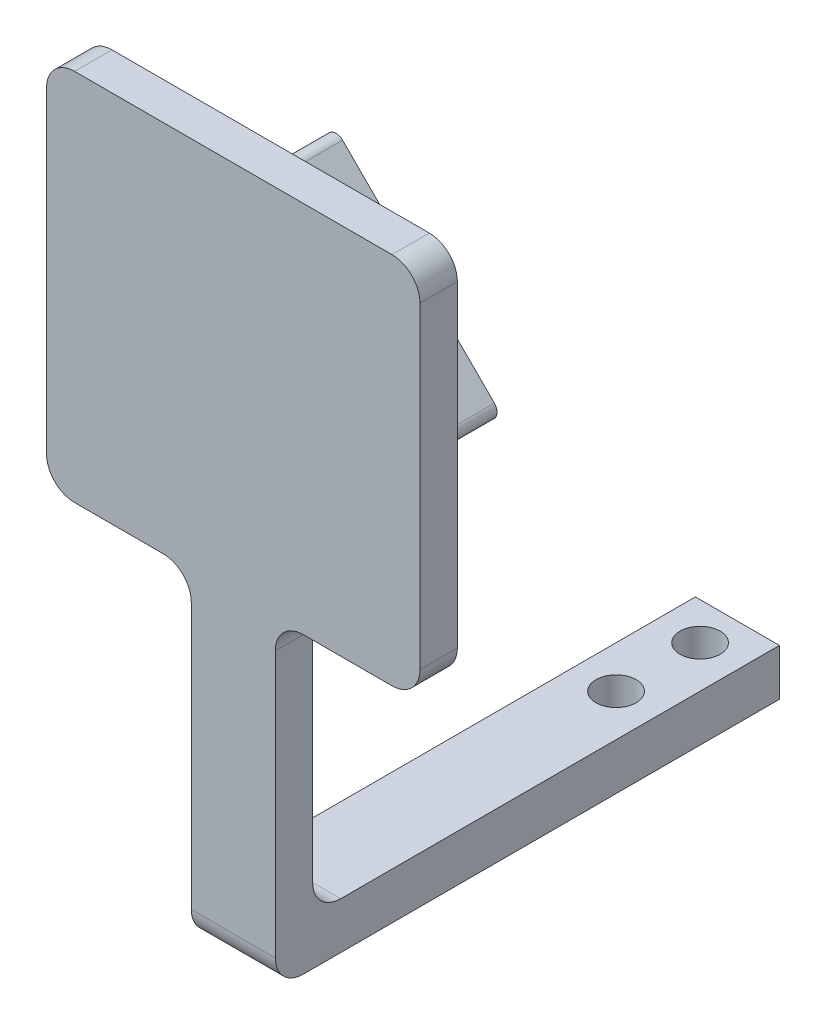
from build123d import *

# Parameters (mm, degrees)
BOSS_EXTRUDE1_DEPTH = 2
SKETCH3_W           = 9
SKETCH3_H           = 50
SKETCH3_R           = 2.15
BOSS_EXTRUDE2_DEPTH = 5
FILLET1_R           = 3
BOSS_EXTRUDE3_DEPTH = 7
CUT_EXTRUDE1_REACH  = 76.971
SKETCH5_R           = 2.6
CUT_EXTRUDE2_REACH  = 79.848
SKETCH7_R           = 2.6
CUT_EXTRUDE3_DEPTH  = 7
FILLET2_R           = 1


with BuildPart() as part:
    # Sketch1 → Boss-Extrude1 (new, symmetric)
    with BuildSketch(Plane.XY):
        Polygon((0, 0), (15.5, 0), (15.5, -34.5), (24.5, -34.5), (24.5, 0), (40, 0), (40, 40), (0, 40), align=None)
    extrude(amount=BOSS_EXTRUDE1_DEPTH, both=True)

    # Sketch3 → Boss-Extrude2 (add)
    with BuildSketch(Plane.XZ.offset(34.5)):
        with Locations((20, -27)):
            Rectangle(SKETCH3_W, SKETCH3_H)
        with Locations(Location((20, -48, 0), (0, 0, 270))):
            Circle(SKETCH3_R, mode=Mode.SUBTRACT)
        with Locations(Location((20, -39, 0), (0, 0, 270))):
            Circle(SKETCH3_R, mode=Mode.SUBTRACT)
    extrude(amount=-BOSS_EXTRUDE2_DEPTH)

    # Fillet1
    fillet1_edges = [part.edges().sort_by_distance(p)[0] for p in [
        (0, 40, 0),
        (40, 40, 0),
        (40, 0, 0),
        (24.5, 0, 0),
        (15.5, 0, 0),
        (0, 0, 0),
        (20, -34.5, 2),
        (20, -29.5, -2),
    ]]
    fillet(fillet1_edges, radius=FILLET1_R)

    # Sketch4 → Boss-Extrude3 (add)
    with BuildSketch(Plane(origin=(0, 0, -2), x_dir=(-1, 0, 0), z_dir=(0, 0, -1))):
        Polygon((-20, 2.32233047), (-37.67766953, 20), (-20, 37.67766953), (-2.32233047, 20), align=None)
        Polygon((-20, 5.150757595), (-34.849242405, 20), (-20, 34.849242405), (-5.150757595, 20), align=None, mode=Mode.SUBTRACT)
    extrude(amount=BOSS_EXTRUDE3_DEPTH)

    # Cut-Extrude1: up to this face of the body (flat: up to its plane)
    cut_extrude1_end = Plane(part.part.faces().sort_by_distance((28.838834765, 28.838834765, -5.5))[0])
    # Sketch5 → Cut-Extrude1 (cut, up to the picked face)
    with BuildSketch(Plane(origin=(11.161165235, 11.161165235, 0), x_dir=(0, 0, 1), z_dir=(-0.7071067811865398, -0.7071067811865552, 0)), mode=Mode.PRIVATE) as cut_extrude1_sk1:
        with Locations(Location((-5.5, 0, 0), (0, 0, 270))):
            Circle(SKETCH5_R)
    cut_extrude1_tool1 = split(extrude(cut_extrude1_sk1.sketch, amount=-CUT_EXTRUDE1_REACH, mode=Mode.PRIVATE), bisect_by=cut_extrude1_end, keep=Keep.BOTH, mode=Mode.PRIVATE)
    add(cut_extrude1_tool1.solids().sort_by(Axis((11.161165, 11.161165, -5.5), (0.7071067811865398, 0.7071067811865552, 0)))[0], mode=Mode.SUBTRACT)

    # Cut-Extrude2: up to this face of the body (flat: up to its plane)
    cut_extrude2_end = Plane(part.part.faces().sort_by_distance((11.161165235, 28.838834765, -5.5))[0])
    # Sketch7 → Cut-Extrude2 (cut, up to the picked face)
    with BuildSketch(Plane(origin=(8.838834765, -8.838834765, 0), x_dir=(0.7071067811865399, 0.7071067811865551, 0), z_dir=(0.7071067811865551, -0.7071067811865399, 0)), mode=Mode.PRIVATE) as cut_extrude2_sk1:
        with Locations((28.284271248, -5.5)):
            Circle(SKETCH7_R)
    cut_extrude2_tool1 = split(extrude(cut_extrude2_sk1.sketch, amount=-CUT_EXTRUDE2_REACH, mode=Mode.PRIVATE), bisect_by=cut_extrude2_end, keep=Keep.BOTH, mode=Mode.PRIVATE)
    add(cut_extrude2_tool1.solids().sort_by(Axis((28.838835, 11.161165, -5.5), (-0.7071067811865551, 0.7071067811865399, 0)))[0], mode=Mode.SUBTRACT)

    # Sketch9 → Cut-Extrude3 (cut)
    with BuildSketch(Plane(origin=(0, 0, -9), x_dir=(-1, 0, 0), z_dir=(0, 0, -1))):
        Polygon((-22.828427125, 5.150757595), (-20, 2.32233047), (-17.171572875, 5.150757595), (-18.585786438, 6.564971157), (-20, 5.150757595), (-21.414213562, 6.564971157), align=None)
    extrude(amount=-CUT_EXTRUDE3_DEPTH, mode=Mode.SUBTRACT)

    # Fillet2
    fillet2_edges = [part.edges().sort_by_distance(p)[0] for p in [
        (21.414213562, 6.564971157, -5.5),
        (18.585786438, 6.564971157, -5.5),
        (17.171572875, 5.150757595, -5.5),
        (22.828427125, 5.150757595, -5.5),
        (5.150757595, 20, -5.5),
        (2.32233047, 20, -5.5),
        (20, 37.67766953, -5.5),
        (20, 34.849242405, -5.5),
        (34.849242405, 20, -5.5),
        (37.67766953, 20, -5.5),
    ]]
    fillet(fillet2_edges, radius=FILLET2_R - 0.0001)  # a hair under: the kernel refuses the full size


solid = part.part
